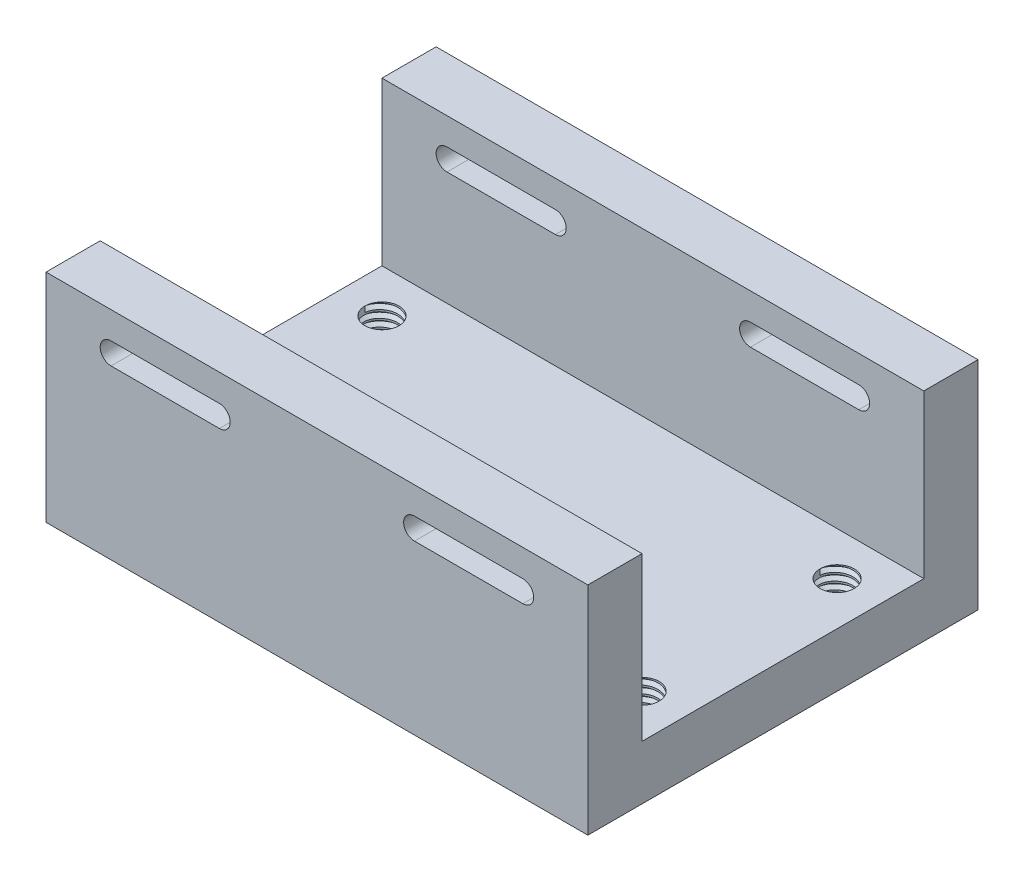
from build123d import *
from build123d.topology import SkipClean

# Parameters (mm, degrees)
SKETCH1_W           = 50
SKETCH1_H           = 26
BOSS_EXTRUDE1_DEPTH = 5
SKETCH2_W           = 50
SKETCH2_H           = 5
BOSS_EXTRUDE2_DEPTH = 20
CUT_EXTRUDE1_DEPTH  = 49.176757882
SKETCH4_R           = 1.575
CUT_EXTRUDE2_DEPTH  = 10
THREAD1_PITCH       = 0.7
THREAD2_PITCH       = 0.7
THREAD3_PITCH       = 0.7
THREAD4_PITCH       = 0.7


with BuildPart() as part:
    # Sketch1 → Boss-Extrude1 (new body)
    with BuildSketch(Plane(origin=(0, 0, 0), x_dir=(1, 0, 0), z_dir=(0, 1, 0))):
        Rectangle(SKETCH1_W, SKETCH1_H)
    extrude(amount=BOSS_EXTRUDE1_DEPTH)

    # Sketch2 → Boss-Extrude2 (add)
    with BuildSketch(Plane(origin=(0, 0, 0), x_dir=(1, 0, 0), z_dir=(0, 1, 0))):
        with Locations((0, -15.5)):
            Rectangle(SKETCH2_W, SKETCH2_H)
        with Locations((0, 15.5)):
            Rectangle(SKETCH2_W, SKETCH2_H)
    extrude(amount=BOSS_EXTRUDE2_DEPTH)

    # Sketch3 → Cut-Extrude1 (cut, through all)
    with BuildSketch(Plane.XY.offset(18)):
        with BuildLine():
            Line((-19, 17.5), (-9, 17.5))
            ThreePointArc((-9, 17.5), (-8, 16.5), (-9, 15.5))
            Line((-9, 15.5), (-19, 15.5))
            ThreePointArc((-19, 15.5), (-20, 16.5), (-19, 17.5))
        make_face()
        with BuildLine():
            Line((19, 17.5), (9, 17.5))
            ThreePointArc((9, 17.5), (8, 16.5), (9, 15.5))
            Line((9, 15.5), (19, 15.5))
            ThreePointArc((19, 15.5), (20, 16.5), (19, 17.5))
        make_face()
    extrude(amount=-CUT_EXTRUDE1_DEPTH, mode=Mode.SUBTRACT)

    # Sketch4 → Cut-Extrude2 (cut)
    with BuildSketch(Plane(origin=(0, 5, 0), x_dir=(1, 0, 0), z_dir=(0, 1, 0))):
        with Locations(Location((-21, 9, 0), (0, 0, 270))):
            Circle(SKETCH4_R)
        with Locations(Location((-21, -9, 0), (0, 0, 90))):
            Circle(SKETCH4_R)
        with Locations(Location((21, -9, 0), (0, 0, 270))):
            Circle(SKETCH4_R)
        with Locations(Location((21, 9, 0), (0, 0, 90))):
            Circle(SKETCH4_R)
    extrude(amount=-CUT_EXTRUDE2_DEPTH, mode=Mode.SUBTRACT)

    # Thread1: arcs per turn and ends read off the stored shape
    # Thread1: the profile of Thread Profile1 profile screwed along a right-hand helix through 14.285714 turns, 6 arcs to a turn; built about Z, then put on its axis
    with SkipClean():  # the faces are left unmerged after this step: merging them gives an invalid solid
        thread1_z = Axis((0, 0, 0), (0, 0, 1))
        thread1_corners = [(1.5747, 0, -0.000173205), (1.953886112, 0, 0.218749999), (1.953886112, 0, 0.306249999), (1.5747, 0, 0.525173203)]
        with BuildLine(mode=Mode.PRIVATE) as thread1_profile:
            Line(thread1_corners[0], thread1_corners[1])
            Line(thread1_corners[1], thread1_corners[2])
            Line(thread1_corners[2], thread1_corners[3])
            Line(thread1_corners[3], thread1_corners[0])
        thread1_cap = Face(thread1_profile.wire())
        thread1_turn_angles = [0, 30, 60, 90, 120, 150, 180, 210, 240, 270, 300, 330, 360]
        thread1_turn_weights = [1, 0.8660254037844387, 1, 0.8660254037844387, 1, 0.8660254037844387, 1, 0.8660254037844387, 1, 0.8660254037844387, 1, 0.8660254037844387, 1]
        thread1_turn_rails = [Edge.make_bspline([Vector(p[0], p[1], 0).rotate(thread1_z, thread1_turn_angles[k]) / thread1_turn_weights[k] + Vector(0, 0, p[2] + THREAD1_PITCH * thread1_turn_angles[k] / 360) for k in range(13)], [0, 0, 0, 1, 1, 2, 2, 3, 3, 4, 4, 5, 5, 6, 6, 6], 2, thread1_turn_weights) for p in thread1_corners]
        thread1_turn_sides = [Face.make_surface_from_curves(thread1_turn_rails[p[0]], thread1_turn_rails[p[1]]) for p in [(0, 1), (1, 2), (2, 3), (3, 0)]]
        thread1_last_angles = [5040, 5070, 5100, 5121.428571429, 5142.857142857]
        thread1_last_weights = [1, 0.8660254037844387, 1, 0.9308737486442035, 1]
        thread1_last_rails = [Edge.make_bspline([Vector(p[0], p[1], 0).rotate(thread1_z, thread1_last_angles[k]) / thread1_last_weights[k] + Vector(0, 0, p[2] + THREAD1_PITCH * thread1_last_angles[k] / 360) for k in range(5)], [0, 0, 0, 1, 1, 2, 2, 2], 2, thread1_last_weights) for p in thread1_corners]
        thread1_last_sides = [Face.make_surface_from_curves(thread1_last_rails[p[0]], thread1_last_rails[p[1]]) for p in [(0, 1), (1, 2), (2, 3), (3, 0)]]
        thread1 = Plane(origin=(21, 5, -9), x_dir=(-1, 0, 0), z_dir=(0, -1, 0)) * Solid(Shell([*[p.moved(Location((0, 0, THREAD1_PITCH * i))) for i in range(14) for p in thread1_turn_sides], *thread1_last_sides, thread1_cap, thread1_cap.rotate(thread1_z, 5142.857142857).moved(Location((0, 0, THREAD1_PITCH * 5142.857142857 / 360)))]))
        add(thread1, mode=Mode.SUBTRACT)

    # Thread2: arcs per turn and ends read off the stored shape
    # Thread2: the profile of Thread Profile2 profile screwed along a right-hand helix through 14.285714 turns, 6 arcs to a turn; built about Z, then put on its axis
    with SkipClean():  # the faces are left unmerged after this step: merging them gives an invalid solid
        thread2_z = Axis((0, 0, 0), (0, 0, 1))
        thread2_corners = [(1.5747, 0, -0.000173205), (1.953886112, 0, 0.218749999), (1.953886112, 0, 0.306249999), (1.5747, 0, 0.525173203)]
        with BuildLine(mode=Mode.PRIVATE) as thread2_profile:
            Line(thread2_corners[0], thread2_corners[1])
            Line(thread2_corners[1], thread2_corners[2])
            Line(thread2_corners[2], thread2_corners[3])
            Line(thread2_corners[3], thread2_corners[0])
        thread2_cap = Face(thread2_profile.wire())
        thread2_turn_angles = [0, 30, 60, 90, 120, 150, 180, 210, 240, 270, 300, 330, 360]
        thread2_turn_weights = [1, 0.8660254037844387, 1, 0.8660254037844387, 1, 0.8660254037844387, 1, 0.8660254037844387, 1, 0.8660254037844387, 1, 0.8660254037844387, 1]
        thread2_turn_rails = [Edge.make_bspline([Vector(p[0], p[1], 0).rotate(thread2_z, thread2_turn_angles[k]) / thread2_turn_weights[k] + Vector(0, 0, p[2] + THREAD2_PITCH * thread2_turn_angles[k] / 360) for k in range(13)], [0, 0, 0, 1, 1, 2, 2, 3, 3, 4, 4, 5, 5, 6, 6, 6], 2, thread2_turn_weights) for p in thread2_corners]
        thread2_turn_sides = [Face.make_surface_from_curves(thread2_turn_rails[p[0]], thread2_turn_rails[p[1]]) for p in [(0, 1), (1, 2), (2, 3), (3, 0)]]
        thread2_last_angles = [5040, 5070, 5100, 5121.428571429, 5142.857142857]
        thread2_last_weights = [1, 0.8660254037844387, 1, 0.9308737486442035, 1]
        thread2_last_rails = [Edge.make_bspline([Vector(p[0], p[1], 0).rotate(thread2_z, thread2_last_angles[k]) / thread2_last_weights[k] + Vector(0, 0, p[2] + THREAD2_PITCH * thread2_last_angles[k] / 360) for k in range(5)], [0, 0, 0, 1, 1, 2, 2, 2], 2, thread2_last_weights) for p in thread2_corners]
        thread2_last_sides = [Face.make_surface_from_curves(thread2_last_rails[p[0]], thread2_last_rails[p[1]]) for p in [(0, 1), (1, 2), (2, 3), (3, 0)]]
        thread2 = Plane(origin=(21, 5, 9), x_dir=(-1, 0, 0), z_dir=(0, -1, 0)) * Solid(Shell([*[p.moved(Location((0, 0, THREAD2_PITCH * i))) for i in range(14) for p in thread2_turn_sides], *thread2_last_sides, thread2_cap, thread2_cap.rotate(thread2_z, 5142.857142857).moved(Location((0, 0, THREAD2_PITCH * 5142.857142857 / 360)))]))
        add(thread2, mode=Mode.SUBTRACT)

    # Thread3: arcs per turn and ends read off the stored shape
    # Thread3: the profile of Thread Profile3 profile screwed along a right-hand helix through 14.285714 turns, 6 arcs to a turn; built about Z, then put on its axis
    with SkipClean():  # the faces are left unmerged after this step: merging them gives an invalid solid
        thread3_z = Axis((0, 0, 0), (0, 0, 1))
        thread3_corners = [(1.5747, 0, -0.000173205), (1.953886113, 0, 0.218749999), (1.953886113, 0, 0.306249999), (1.5747, 0, 0.525173203)]
        with BuildLine(mode=Mode.PRIVATE) as thread3_profile:
            Line(thread3_corners[0], thread3_corners[1])
            Line(thread3_corners[1], thread3_corners[2])
            Line(thread3_corners[2], thread3_corners[3])
            Line(thread3_corners[3], thread3_corners[0])
        thread3_cap = Face(thread3_profile.wire())
        thread3_turn_angles = [0, 30, 60, 90, 120, 150, 180, 210, 240, 270, 300, 330, 360]
        thread3_turn_weights = [1, 0.8660254037844387, 1, 0.8660254037844387, 1, 0.8660254037844387, 1, 0.8660254037844387, 1, 0.8660254037844387, 1, 0.8660254037844387, 1]
        thread3_turn_rails = [Edge.make_bspline([Vector(p[0], p[1], 0).rotate(thread3_z, thread3_turn_angles[k]) / thread3_turn_weights[k] + Vector(0, 0, p[2] + THREAD3_PITCH * thread3_turn_angles[k] / 360) for k in range(13)], [0, 0, 0, 1, 1, 2, 2, 3, 3, 4, 4, 5, 5, 6, 6, 6], 2, thread3_turn_weights) for p in thread3_corners]
        thread3_turn_sides = [Face.make_surface_from_curves(thread3_turn_rails[p[0]], thread3_turn_rails[p[1]]) for p in [(0, 1), (1, 2), (2, 3), (3, 0)]]
        thread3_last_angles = [5040, 5070, 5100, 5121.428571429, 5142.857142857]
        thread3_last_weights = [1, 0.8660254037844387, 1, 0.9308737486442035, 1]
        thread3_last_rails = [Edge.make_bspline([Vector(p[0], p[1], 0).rotate(thread3_z, thread3_last_angles[k]) / thread3_last_weights[k] + Vector(0, 0, p[2] + THREAD3_PITCH * thread3_last_angles[k] / 360) for k in range(5)], [0, 0, 0, 1, 1, 2, 2, 2], 2, thread3_last_weights) for p in thread3_corners]
        thread3_last_sides = [Face.make_surface_from_curves(thread3_last_rails[p[0]], thread3_last_rails[p[1]]) for p in [(0, 1), (1, 2), (2, 3), (3, 0)]]
        thread3 = Plane(origin=(-21, 5, 9), x_dir=(-1, 0, 0), z_dir=(0, -1, 0)) * Solid(Shell([*[p.moved(Location((0, 0, THREAD3_PITCH * i))) for i in range(14) for p in thread3_turn_sides], *thread3_last_sides, thread3_cap, thread3_cap.rotate(thread3_z, 5142.857142857).moved(Location((0, 0, THREAD3_PITCH * 5142.857142857 / 360)))]))
        add(thread3, mode=Mode.SUBTRACT)

    # Thread4: arcs per turn and ends read off the stored shape
    # Thread4: the profile of Thread Profile4 profile screwed along a right-hand helix through 14.285714 turns, 6 arcs to a turn; built about Z, then put on its axis
    with SkipClean():  # the faces are left unmerged after this step: merging them gives an invalid solid
        thread4_z = Axis((0, 0, 0), (0, 0, 1))
        thread4_corners = [(1.5747, 0, -0.000173205), (1.953886113, 0, 0.218749999), (1.953886113, 0, 0.306249999), (1.5747, 0, 0.525173203)]
        with BuildLine(mode=Mode.PRIVATE) as thread4_profile:
            Line(thread4_corners[0], thread4_corners[1])
            Line(thread4_corners[1], thread4_corners[2])
            Line(thread4_corners[2], thread4_corners[3])
            Line(thread4_corners[3], thread4_corners[0])
        thread4_cap = Face(thread4_profile.wire())
        thread4_turn_angles = [0, 30, 60, 90, 120, 150, 180, 210, 240, 270, 300, 330, 360]
        thread4_turn_weights = [1, 0.8660254037844387, 1, 0.8660254037844387, 1, 0.8660254037844387, 1, 0.8660254037844387, 1, 0.8660254037844387, 1, 0.8660254037844387, 1]
        thread4_turn_rails = [Edge.make_bspline([Vector(p[0], p[1], 0).rotate(thread4_z, thread4_turn_angles[k]) / thread4_turn_weights[k] + Vector(0, 0, p[2] + THREAD4_PITCH * thread4_turn_angles[k] / 360) for k in range(13)], [0, 0, 0, 1, 1, 2, 2, 3, 3, 4, 4, 5, 5, 6, 6, 6], 2, thread4_turn_weights) for p in thread4_corners]
        thread4_turn_sides = [Face.make_surface_from_curves(thread4_turn_rails[p[0]], thread4_turn_rails[p[1]]) for p in [(0, 1), (1, 2), (2, 3), (3, 0)]]
        thread4_last_angles = [5040, 5070, 5100, 5121.428571429, 5142.857142857]
        thread4_last_weights = [1, 0.8660254037844387, 1, 0.9308737486442035, 1]
        thread4_last_rails = [Edge.make_bspline([Vector(p[0], p[1], 0).rotate(thread4_z, thread4_last_angles[k]) / thread4_last_weights[k] + Vector(0, 0, p[2] + THREAD4_PITCH * thread4_last_angles[k] / 360) for k in range(5)], [0, 0, 0, 1, 1, 2, 2, 2], 2, thread4_last_weights) for p in thread4_corners]
        thread4_last_sides = [Face.make_surface_from_curves(thread4_last_rails[p[0]], thread4_last_rails[p[1]]) for p in [(0, 1), (1, 2), (2, 3), (3, 0)]]
        thread4 = Plane(origin=(-21, 5, -9), x_dir=(-1, 0, 0), z_dir=(0, -1, 0)) * Solid(Shell([*[p.moved(Location((0, 0, THREAD4_PITCH * i))) for i in range(14) for p in thread4_turn_sides], *thread4_last_sides, thread4_cap, thread4_cap.rotate(thread4_z, 5142.857142857).moved(Location((0, 0, THREAD4_PITCH * 5142.857142857 / 360)))]))
        add(thread4, mode=Mode.SUBTRACT)


solid = part.part
